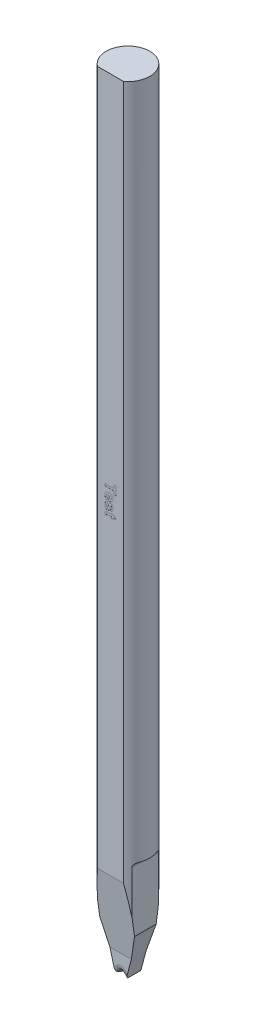
from build123d import *

# Parameters (mm, degrees)
SKETCH_TL_CUTTING_R       = 1.99771
TL_CUTTING_DEPTH          = 72.009
SKETCH_TDF_GRINDING_W     = 4.01542
SKETCH_TDF_GRINDING_H     = 4.01542
TDF_GRINDING_DEPTH        = 73.064400167
ENGRAVING_DEPTH           = 0.005
VW_VR_GRINDING_DEPTH      = 2.00771
VW_VR_GRINDING_DEPTH_BACK = 2.00771
ISA_GRINDING_DEPTH        = 2.00771
ISA_GRINDING_DEPTH_BACK   = 2.00771
PRE_FRX_BRX_DEPTH         = 2.00771
PRE_FRX_BRX_DEPTH_BACK    = 2.00771
SKETCH_PRE_FRX_BRX_W      = 1.33334
SKETCH_PRE_FRX_BRX_H      = 1.80086
FR_EDM_R                  = 0.50038
BR_EDM_R                  = 0.24892
FA_BA_GRINDING_DEPTH      = 2.00771
FA_BA_GRINDING_DEPTH_BACK = 2.00771


with BuildPart() as part:
    # sketch_TL_cutting → TL_cutting (new body)
    with BuildSketch(Plane(origin=(0, 0, 0), x_dir=(1, 0, 0), z_dir=(0, 1, 0))):
        Circle(SKETCH_TL_CUTTING_R)
    extrude(amount=TL_CUTTING_DEPTH)

    # sketch_TDF_grinding → TDF_grinding (cut, through all)
    with BuildSketch(Plane(origin=(0, 0, 0), x_dir=(1, 0, 0), z_dir=(0, 1, 0))):
        with Locations((0, -3.60918)):
            Rectangle(SKETCH_TDF_GRINDING_W, SKETCH_TDF_GRINDING_H)
    extrude(amount=TDF_GRINDING_DEPTH, mode=Mode.SUBTRACT)

    # sketch_engraving → engraving (cut)
    # profile 1 of 4: a face of its own
    with BuildSketch(Plane.XY.offset(1.60147)):
        Polygon((-0.5, 39.271616667), (0.333333333, 39.271616667), (0.333333333, 39.566488462), (0.5, 39.566488462), (0.5, 38.784437179), (0.333333333, 38.784437179), (0.333333333, 39.079308974), (-0.5, 39.079308974), align=None)
    # profile 2 of 4: a face of its own
    with BuildSketch(Plane.XY.offset(1.60147)):
        with BuildLine():
            Line((-0.269230769, 38.245975641), (-0.294871795, 38.053667949))
            add(Edge.make_bspline(
                [(-0.294871795, 38.053667949), (-0.303536255, 38.05681341), (-0.32057243, 38.062998057), (-0.344863965, 38.074297447), (-0.36753558, 38.086927941), (-0.38870841, 38.100828818), (-0.40841008, 38.115948344), (-0.426226149, 38.132786464), (-0.442819851, 38.150522903), (-0.457401048, 38.169899569), (-0.470514378, 38.190430953), (-0.481988402, 38.212220233), (-0.491332973, 38.235441665), (-0.499158418, 38.2597436), (-0.505404699, 38.285236347), (-0.509771463, 38.312023912), (-0.51242458, 38.340071927), (-0.512686872, 38.359217543), (-0.512820513, 38.368972436)],
                knots=[0, 0, 0, 0, 1.071172907, 2.106154283, 3.1104349, 4.085737425, 5.048416355, 5.993087888, 6.932482331, 7.868664062, 8.80754521, 9.762367971, 10.726735429, 11.713584758, 12.728370439, 13.774815933, 14.866245336, 16, 16, 16, 16], degree=3))
            add(Edge.make_bspline(
                [(-0.512820513, 38.368972436), (-0.512443282, 38.384215689), (-0.51171073, 38.413816927), (-0.505852845, 38.456649619), (-0.496231539, 38.496468957), (-0.482996444, 38.533340518), (-0.465262586, 38.566968048), (-0.443980436, 38.597603584), (-0.418772334, 38.625277377), (-0.399264925, 38.640792304), (-0.389423077, 38.648619872)],
                knots=[0, 0, 0, 0, 1.15090686, 2.234973544, 3.257507168, 4.240282073, 5.185422152, 6.119941203, 7.051475585, 8, 8, 8, 8], degree=3))
            add(Edge.make_bspline(
                [(-0.389423077, 38.648619872), (-0.381046549, 38.654394615), (-0.364178666, 38.666023262), (-0.336856894, 38.680508975), (-0.307933811, 38.692778192), (-0.277558503, 38.703026223), (-0.245440266, 38.710801085), (-0.211772448, 38.716423673), (-0.176408554, 38.719566462), (-0.152316287, 38.7200751), (-0.140024038, 38.720334615)],
                knots=[0, 0, 0, 0, 0.924739034, 1.862154457, 2.806332648, 3.78003102, 4.774289357, 5.808656063, 6.881942244, 8, 8, 8, 8], degree=3))
            add(Edge.make_bspline(
                [(-0.140024038, 38.720334615), (-0.125455951, 38.720092004), (-0.096984123, 38.719617846), (-0.055513373, 38.715154498), (-0.016425807, 38.707818358), (0.020119322, 38.697410859), (0.054294407, 38.68413375), (0.086062076, 38.66795031), (0.115338437, 38.648566538), (0.141890673, 38.626338649), (0.165678093, 38.601889773), (0.186654734, 38.575901172), (0.204171816, 38.548142799), (0.218793413, 38.519037282), (0.22973775, 38.488097916), (0.237794287, 38.455712574), (0.242700593, 38.421739484), (0.243290251, 38.398569286), (0.243589744, 38.386800962)],
                knots=[0, 0, 0, 0, 1.22208028, 2.38843015, 3.495001974, 4.555551, 5.572102979, 6.566928721, 7.541284444, 8.51191166, 9.466805643, 10.399597494, 11.308905182, 12.215983304, 13.126946664, 14.056451325, 15.012856426, 16, 16, 16, 16], degree=3))
            add(Edge.make_bspline(
                [(0.243589744, 38.386800962), (0.243311261, 38.373629824), (0.242766301, 38.347855288), (0.237650471, 38.310275991), (0.229328986, 38.274795107), (0.217373094, 38.241526508), (0.202375393, 38.21026058), (0.183809309, 38.18120302), (0.161721866, 38.15441694), (0.136526927, 38.129657507), (0.107657568, 38.107731168), (0.075306929, 38.088791461), (0.039386169, 38.073001438), (-6.4395e-05, 38.06017711), (-0.043155579, 38.050702551), (-0.089766999, 38.044217904), (-0.139896801, 38.040520273), (-0.174473137, 38.040736108), (-0.192307692, 38.040847436)],
                knots=[0, 0, 0, 0, 0.994914541, 1.946943474, 2.860007193, 3.744253739, 4.613162343, 5.475451996, 6.343187588, 7.231728884, 8.139057486, 9.075471918, 10.058180036, 11.098621179, 12.205332334, 13.387827392, 14.65263521, 16, 16, 16, 16], degree=3))
            Line((-0.192307692, 38.040847436), (-0.192307692, 38.528026923))
            add(Edge.make_bspline(
                [(-0.192307692, 38.528026923), (-0.199190121, 38.527709192), (-0.212592416, 38.527090467), (-0.232195578, 38.524796627), (-0.250479259, 38.520657909), (-0.267812634, 38.515788971), (-0.283741268, 38.50914089), (-0.298585088, 38.501254096), (-0.312263908, 38.492043492), (-0.324637591, 38.481432151), (-0.335614883, 38.46980259), (-0.345276708, 38.457539783), (-0.353640982, 38.4446797), (-0.360224098, 38.430905392), (-0.365494916, 38.416500027), (-0.36902659, 38.40135782), (-0.371322908, 38.385602139), (-0.371635397, 38.374856811), (-0.371794872, 38.369373077)],
                knots=[0, 0, 0, 0, 1.231638706, 2.398395625, 3.522289669, 4.579947828, 5.613000372, 6.600997726, 7.58103015, 8.554716894, 9.508889492, 10.435482506, 11.342805004, 12.245087657, 13.158904806, 14.079635201, 15.019967576, 16, 16, 16, 16], degree=3))
            add(Edge.make_bspline(
                [(-0.371794872, 38.369373077), (-0.37147122, 38.362073831), (-0.370844355, 38.347936282), (-0.366452232, 38.327557955), (-0.358712143, 38.309068041), (-0.34792154, 38.292272797), (-0.333591606, 38.277328375), (-0.315339539, 38.264799025), (-0.293735149, 38.253844255), (-0.277667648, 38.248684811), (-0.269230769, 38.245975641)],
                knots=[0, 0, 0, 0, 1.004430367, 1.945431754, 2.851730883, 3.749038912, 4.678525969, 5.68064125, 6.782128749, 8, 8, 8, 8], degree=3))
        make_face()
        with BuildLine():
            add(Edge.make_bspline(
                [(-0.076923077, 38.233155128), (-0.0698403, 38.233483639), (-0.056046098, 38.234123437), (-0.035946701, 38.236260056), (-0.017148581, 38.239753965), (0.000200148, 38.244909045), (0.016332408, 38.250857578), (0.031252693, 38.258017474), (0.044751188, 38.266665927), (0.056718236, 38.276608372), (0.067663617, 38.28708548), (0.076749299, 38.298677324), (0.084970517, 38.310417813), (0.091312261, 38.322949906), (0.09644632, 38.335935061), (0.100044461, 38.349509996), (0.102017666, 38.363706733), (0.102379943, 38.373306988), (0.102564103, 38.378187179)],
                knots=[0, 0, 0, 0, 1.317155349, 2.565252013, 3.752617023, 4.863710936, 5.923691592, 6.944619286, 7.932291025, 8.893346204, 9.832040666, 10.740742434, 11.625065814, 12.490654946, 13.343074709, 14.215747339, 15.092993572, 16, 16, 16, 16], degree=3))
            add(Edge.make_bspline(
                [(0.102564103, 38.378187179), (0.102394824, 38.383402132), (0.102061251, 38.393678456), (0.099884751, 38.408748379), (0.096024349, 38.423032459), (0.09079949, 38.436639555), (0.083918898, 38.449540507), (0.0754807, 38.461735603), (0.065590542, 38.473270723), (0.058097667, 38.480221161), (0.054286859, 38.48375609)],
                knots=[0, 0, 0, 0, 1.043516863, 2.056302107, 3.038302912, 3.998520634, 4.966791607, 5.956307719, 6.960596886, 8, 8, 8, 8], degree=3))
            add(Edge.make_bspline(
                [(0.054286859, 38.48375609), (0.050143389, 38.487049206), (0.04181864, 38.493665486), (0.028026538, 38.502086823), (0.013220128, 38.509308805), (-0.002752654, 38.515151047), (-0.019802657, 38.519527844), (-0.037911914, 38.522448646), (-0.057052364, 38.524307277), (-0.070174406, 38.524514764), (-0.076923077, 38.524621474)],
                knots=[0, 0, 0, 0, 0.903766344, 1.81577923, 2.754803886, 3.715080786, 4.716965023, 5.758108642, 6.846994466, 8, 8, 8, 8], degree=3))
            Line((-0.076923077, 38.524621474), (-0.076923077, 38.233155128))
        make_face(mode=Mode.SUBTRACT)
    # profile 3 of 4: a face of its own
    with BuildSketch(Plane.XY.offset(1.60147)):
        with BuildLine():
            Line((-0.282051282, 37.963924359), (-0.256410256, 37.771616667))
            add(Edge.make_bspline(
                [(-0.256410256, 37.771616667), (-0.265392316, 37.769308786), (-0.282694005, 37.764863233), (-0.306215409, 37.753602879), (-0.326584524, 37.739486729), (-0.343301626, 37.721699528), (-0.356462242, 37.70035559), (-0.365240358, 37.675137989), (-0.37099337, 37.646408413), (-0.37151826, 37.62594851), (-0.371794872, 37.615166346)],
                knots=[0, 0, 0, 0, 1.039319445, 2.001988807, 2.911187514, 3.807680854, 4.723381073, 5.705509029, 6.790826147, 8, 8, 8, 8], degree=3))
            add(Edge.make_bspline(
                [(-0.371794872, 37.615166346), (-0.371595476, 37.6033799), (-0.371221553, 37.581277061), (-0.365704055, 37.55056632), (-0.358276706, 37.523830835), (-0.349217718, 37.509115088), (-0.344951923, 37.502185577)],
                knots=[0, 0, 0, 0, 1.198484229, 2.247488828, 3.174758401, 4, 4, 4, 4], degree=3))
            add(Edge.make_bspline(
                [(-0.344951923, 37.502185577), (-0.341742613, 37.498232291), (-0.33550118, 37.490543982), (-0.322943507, 37.482741952), (-0.309159996, 37.477548698), (-0.299329041, 37.477017951), (-0.294270833, 37.476744872)],
                knots=[0, 0, 0, 0, 1.030872991, 2.004830756, 2.973448591, 4, 4, 4, 4], degree=3))
            add(Edge.make_bspline(
                [(-0.294270833, 37.476744872), (-0.29084777, 37.476875774), (-0.284161693, 37.477131458), (-0.274600311, 37.479806895), (-0.265958556, 37.484297368), (-0.261079044, 37.488462599), (-0.258613782, 37.490566987)],
                knots=[0, 0, 0, 0, 1.045349703, 2.041822997, 3.010676005, 4, 4, 4, 4], degree=3))
            add(Edge.make_bspline(
                [(-0.258613782, 37.490566987), (-0.256288912, 37.493632785), (-0.250848162, 37.500807485), (-0.244943535, 37.515139431), (-0.238900398, 37.533545958), (-0.235595409, 37.547422737), (-0.233774038, 37.555070192)],
                knots=[0, 0, 0, 0, 0.66039037, 1.545471194, 2.647315926, 4, 4, 4, 4], degree=3))
            add(Edge.make_bspline(
                [(-0.233774038, 37.555070192), (-0.229705714, 37.573716174), (-0.22194668, 37.609277449), (-0.209757361, 37.659778792), (-0.19774553, 37.704848274), (-0.186203797, 37.744635975), (-0.174918001, 37.779106417), (-0.163759522, 37.808213265), (-0.153049809, 37.832079784), (-0.144879526, 37.845529946), (-0.141225962, 37.851544551)],
                knots=[0, 0, 0, 0, 1.469060602, 2.801765397, 3.998694248, 5.05919304, 5.990566457, 6.789528243, 7.45870461, 8, 8, 8, 8], degree=3))
            add(Edge.make_bspline(
                [(-0.141225962, 37.851544551), (-0.136226873, 37.858402589), (-0.126466322, 37.871792676), (-0.109659896, 37.889628181), (-0.091386741, 37.904751367), (-0.071590355, 37.917116522), (-0.050318141, 37.926554447), (-0.027668833, 37.93345572), (-0.003546555, 37.937452085), (0.013006297, 37.938002888), (0.021434295, 37.938283333)],
                knots=[0, 0, 0, 0, 1.056974227, 2.063706289, 3.045111424, 4.005796011, 4.963194591, 5.937303459, 6.949763919, 8, 8, 8, 8], degree=3))
            add(Edge.make_bspline(
                [(0.021434295, 37.938283333), (0.029124721, 37.938038093), (0.04431443, 37.937553707), (0.06658025, 37.934147557), (0.08788195, 37.928268829), (0.108244702, 37.919987356), (0.127669101, 37.909371186), (0.146109736, 37.896355985), (0.163499189, 37.88105958), (0.18008332, 37.863595441), (0.195101302, 37.843560205), (0.208193344, 37.820898789), (0.219189739, 37.795682252), (0.228160641, 37.767891932), (0.235116926, 37.737522892), (0.240034197, 37.704574691), (0.243059894, 37.669109271), (0.243409494, 37.644619752), (0.243589744, 37.631993269)],
                knots=[0, 0, 0, 0, 0.866628782, 1.711717909, 2.531497577, 3.35182975, 4.18367977, 5.02092497, 5.890294189, 6.790012725, 7.730721042, 8.705258537, 9.733001209, 10.825364086, 11.991866675, 13.2403337, 14.577151382, 16, 16, 16, 16], degree=3))
            add(Edge.make_bspline(
                [(0.243589744, 37.631993269), (0.243446899, 37.619969386), (0.243169634, 37.596630784), (0.240731219, 37.562865029), (0.236899188, 37.531447838), (0.230948561, 37.502523753), (0.223974046, 37.475757243), (0.214898634, 37.451540721), (0.204526083, 37.429543073), (0.19215876, 37.410057891), (0.178364946, 37.392312816), (0.162861914, 37.376343528), (0.145977964, 37.361660901), (0.127601745, 37.348295817), (0.107595464, 37.336522221), (0.085933763, 37.326346763), (0.062896123, 37.317199482), (0.046718542, 37.312484647), (0.038461538, 37.310078205)],
                knots=[0, 0, 0, 0, 1.38031105, 2.679211982, 3.884975083, 5.011116117, 6.067453267, 7.057174624, 7.976132094, 8.854607518, 9.701157373, 10.55241532, 11.405604341, 12.267429654, 13.157569633, 14.066300783, 15.01304394, 16, 16, 16, 16], degree=3))
            Line((0.038461538, 37.310078205), (0.012820513, 37.502385897))
            add(Edge.make_bspline(
                [(0.012820513, 37.502385897), (0.019716836, 37.504290158), (0.033104434, 37.507986834), (0.051141649, 37.517171289), (0.066892754, 37.528329959), (0.079947134, 37.542237254), (0.090451531, 37.559028536), (0.097449696, 37.579068362), (0.101956518, 37.602011397), (0.102353946, 37.618347086), (0.102564103, 37.626985256)],
                knots=[0, 0, 0, 0, 1.018112573, 1.976427386, 2.86989064, 3.759232895, 4.678909429, 5.673224298, 6.76962116, 8, 8, 8, 8], degree=3))
            add(Edge.make_bspline(
                [(0.102564103, 37.626985256), (0.102424935, 37.637692738), (0.102166286, 37.657593004), (0.098045863, 37.684877454), (0.092323932, 37.707867567), (0.085068416, 37.720248276), (0.081730769, 37.72594359)],
                knots=[0, 0, 0, 0, 1.252081424, 2.327041614, 3.230413832, 4, 4, 4, 4], degree=3))
            add(Edge.make_bspline(
                [(0.081730769, 37.72594359), (0.079197183, 37.729025647), (0.074335374, 37.73493994), (0.064913663, 37.741325197), (0.054472552, 37.745380868), (0.047046059, 37.745775133), (0.043269231, 37.745975641)],
                knots=[0, 0, 0, 0, 1.057832138, 2.029920023, 2.998093444, 4, 4, 4, 4], degree=3))
            add(Edge.make_bspline(
                [(0.043269231, 37.745975641), (0.040033897, 37.745731951), (0.033581253, 37.745245928), (0.024317894, 37.741659065), (0.015848023, 37.735669869), (0.011363278, 37.730206983), (0.009014423, 37.727345833)],
                knots=[0, 0, 0, 0, 0.958252903, 1.911167308, 2.905987877, 4, 4, 4, 4], degree=3))
            add(Edge.make_bspline(
                [(0.009014423, 37.727345833), (0.007272068, 37.724647565), (0.003109312, 37.718200986), (-0.001987057, 37.705738151), (-0.007675168, 37.689579504), (-0.014111167, 37.66960725), (-0.021107365, 37.645777407), (-0.028443749, 37.617971341), (-0.036209836, 37.586289843), (-0.044306367, 37.551842427), (-0.052630208, 37.516856792), (-0.061887965, 37.483641001), (-0.071549097, 37.453239038), (-0.082070854, 37.425689873), (-0.092726589, 37.400866602), (-0.103967718, 37.378881411), (-0.115635077, 37.359626043), (-0.124552329, 37.348458363), (-0.12880609, 37.34313109)],
                knots=[0, 0, 0, 0, 0.374467347, 0.894660112, 1.565561736, 2.376893081, 3.344161852, 4.465830414, 5.734896654, 7.153471884, 8.598442955, 9.934182422, 11.179548312, 12.322244199, 13.376910086, 14.332509539, 15.204563813, 16, 16, 16, 16], degree=3))
            add(Edge.make_bspline(
                [(-0.12880609, 37.34313109), (-0.133161207, 37.338397939), (-0.141766598, 37.329045582), (-0.156708359, 37.317267826), (-0.172517892, 37.306827029), (-0.189865737, 37.298743237), (-0.208297358, 37.292224129), (-0.22803715, 37.287604372), (-0.249067342, 37.285099915), (-0.263482048, 37.284661013), (-0.270833333, 37.284437179)],
                knots=[0, 0, 0, 0, 0.971012965, 1.9186502, 2.868006896, 3.82989672, 4.803792202, 5.820095146, 6.888280979, 8, 8, 8, 8], degree=3))
            add(Edge.make_bspline(
                [(-0.270833333, 37.284437179), (-0.278992426, 37.284735435), (-0.295065709, 37.285322994), (-0.31877832, 37.289130371), (-0.34148056, 37.29590885), (-0.363516332, 37.304828098), (-0.384457432, 37.316865706), (-0.404505714, 37.331398777), (-0.423895683, 37.348291114), (-0.442088641, 37.367910642), (-0.458702848, 37.390179566), (-0.473419718, 37.414886937), (-0.485630501, 37.442216147), (-0.495629007, 37.472011312), (-0.503343888, 37.504335073), (-0.50897222, 37.5391443), (-0.51206406, 37.576448424), (-0.512563429, 37.602140104), (-0.512820513, 37.615366667)],
                knots=[0, 0, 0, 0, 0.853005228, 1.680406763, 2.502135431, 3.325285981, 4.159928718, 5.020072903, 5.910500533, 6.844018396, 7.811498054, 8.809909951, 9.84399402, 10.934451331, 12.090792638, 13.314110396, 14.617253208, 16, 16, 16, 16], degree=3))
            add(Edge.make_bspline(
                [(-0.512820513, 37.615366667), (-0.512612848, 37.62745682), (-0.51220841, 37.65100301), (-0.509517578, 37.685359126), (-0.504407099, 37.717718929), (-0.497724819, 37.748140888), (-0.489040825, 37.776683279), (-0.478560901, 37.803305401), (-0.465826863, 37.827975098), (-0.451129931, 37.85061131), (-0.434940139, 37.871488229), (-0.417179349, 37.890400578), (-0.398157879, 37.907538513), (-0.377590042, 37.922532075), (-0.355813358, 37.935929627), (-0.332587631, 37.947268496), (-0.307935086, 37.956851386), (-0.290780182, 37.961539112), (-0.282051282, 37.963924359)],
                knots=[0, 0, 0, 0, 1.27602789, 2.485129288, 3.633323873, 4.730967468, 5.769800648, 6.778755409, 7.74637841, 8.694428407, 9.62340196, 10.530821678, 11.429165597, 12.321379864, 13.213343615, 14.124177522, 15.045528489, 16, 16, 16, 16], degree=3))
        make_face()
    # profile 4 of 4: a face of its own
    with BuildSketch(Plane.XY.offset(1.60147)):
        with BuildLine():
            Line((0.230769231, 36.771616667), (0.08974359, 36.771616667))
            Line((0.08974359, 36.771616667), (0.08974359, 36.912642308))
            Line((0.08974359, 36.912642308), (-0.224358974, 36.912642308))
            add(Edge.make_bspline(
                [(-0.224358974, 36.912642308), (-0.231904339, 36.912655556), (-0.246127351, 36.91268053), (-0.266228543, 36.912516237), (-0.283853768, 36.912035979), (-0.299018236, 36.911753629), (-0.311701045, 36.911074066), (-0.321861303, 36.910566773), (-0.329566697, 36.909844169), (-0.338907815, 36.908116455), (-0.35057578, 36.903088956), (-0.360389431, 36.893421483), (-0.366182432, 36.883899126), (-0.369474906, 36.875870251), (-0.371514578, 36.867071013), (-0.371700117, 36.86090399), (-0.371794872, 36.857754487)],
                knots=[0, 0, 0, 0, 1.773599637, 3.343235314, 4.724802322, 5.918078765, 6.908020279, 7.709878159, 8.309605123, 8.725167438, 9.94114383, 11.228754835, 11.890951744, 12.552590386, 13.260806876, 14, 14, 14, 14], degree=3))
            add(Edge.make_bspline(
                [(-0.371794872, 36.857754487), (-0.371507964, 36.852599495), (-0.37087716, 36.841265574), (-0.367095421, 36.822790849), (-0.361305779, 36.801332787), (-0.356131124, 36.786144648), (-0.353365385, 36.778026923)],
                knots=[0, 0, 0, 0, 0.75345353, 1.656565626, 2.747486109, 4, 4, 4, 4], degree=3))
            Line((-0.353365385, 36.778026923), (-0.487379808, 36.758796154))
            add(Edge.make_bspline(
                [(-0.487379808, 36.758796154), (-0.491390152, 36.770473487), (-0.499569528, 36.79429022), (-0.506906498, 36.832144946), (-0.512003384, 36.872037386), (-0.512543433, 36.899403162), (-0.512820513, 36.91344359)],
                knots=[0, 0, 0, 0, 0.939563481, 1.916305015, 2.930928536, 4, 4, 4, 4], degree=3))
            add(Edge.make_bspline(
                [(-0.512820513, 36.91344359), (-0.512564303, 36.922066227), (-0.512063975, 36.938904556), (-0.50889268, 36.963561395), (-0.50326966, 36.986850275), (-0.495519476, 37.008603835), (-0.485995694, 37.028249445), (-0.475305475, 37.045552282), (-0.462868601, 37.059745517), (-0.449141562, 37.071601308), (-0.433202705, 37.080952612), (-0.415065056, 37.088376561), (-0.394648734, 37.094756812), (-0.380046946, 37.097370521), (-0.372395833, 37.098740064)],
                knots=[0, 0, 0, 0, 1.203015215, 2.349253984, 3.460901624, 4.539344044, 5.564274864, 6.502382232, 7.367332183, 8.186789841, 9.022345106, 9.932420497, 10.916620053, 12, 12, 12, 12], degree=3))
            add(Edge.make_bspline(
                [(-0.372395833, 37.098740064), (-0.369192653, 37.099220274), (-0.362066116, 37.100288659), (-0.35025766, 37.101738229), (-0.336212257, 37.102632671), (-0.319980191, 37.103365635), (-0.301558032, 37.104305843), (-0.280981809, 37.104504627), (-0.258215711, 37.105079957), (-0.242321525, 37.104994749), (-0.233974359, 37.10495)],
                knots=[0, 0, 0, 0, 0.560521704, 1.24706641, 2.057998689, 2.995119087, 4.059211621, 5.249632546, 6.555586685, 8, 8, 8, 8], degree=3))
            Line((-0.233974359, 37.10495), (0.08974359, 37.10495))
            Line((0.08974359, 37.10495), (0.08974359, 37.19469359))
            Line((0.08974359, 37.19469359), (0.230769231, 37.19469359))
            Line((0.230769231, 37.19469359), (0.230769231, 37.10495))
            Line((0.230769231, 37.10495), (0.371794872, 37.10495))
            Line((0.371794872, 37.10495), (0.487179487, 36.912642308))
            Line((0.487179487, 36.912642308), (0.230769231, 36.912642308))
            Line((0.230769231, 36.912642308), (0.230769231, 36.771616667))
        make_face()
    extrude(amount=-ENGRAVING_DEPTH, mode=Mode.SUBTRACT)

    # sketch_VW_VR_grinding → VW_VR_grinding (cut, two sides: drawn at the far end of the back side and taken through both)
    with BuildSketch(Plane.XY.offset(-VW_VR_GRINDING_DEPTH_BACK)):
        with BuildLine():
            Line((-1.59004, -0.01), (-1.59004, 9.681972))
            ThreePointArc((-1.59004, 9.681972), (-1.683182387, 9.906837613), (-1.908048, 9.99998))
            Line((-1.908048, 9.99998), (-2.00771, 9.99998))
            Line((-2.00771, 9.99998), (-2.00771, -0.01))
            Line((-2.00771, -0.01), (-1.59004, -0.01))
        make_face()
        with BuildLine():
            Line((1.59004, -0.01), (1.59004, 9.681972))
            ThreePointArc((1.59004, 9.681972), (1.683182387, 9.906837613), (1.908048, 9.99998))
            Line((1.908048, 9.99998), (2.00771, 9.99998))
            Line((2.00771, 9.99998), (2.00771, -0.01))
            Line((2.00771, -0.01), (1.59004, -0.01))
        make_face()
    extrude(amount=VW_VR_GRINDING_DEPTH + VW_VR_GRINDING_DEPTH_BACK, mode=Mode.SUBTRACT)

    # sketch_ISA_grinding → ISA_grinding (cut, two sides: drawn at the far end of the back side and taken through both)
    with BuildSketch(Plane.XY.offset(-ISA_GRINDING_DEPTH_BACK)):
        Polygon((-0.50038, 0), (-2.00771, 5.625432144), (-2.00771, -0.01), (2.00771, -0.01), (2.00771, 5.625432144), (0.50038, 0), align=None)
    extrude(amount=ISA_GRINDING_DEPTH + ISA_GRINDING_DEPTH_BACK, mode=Mode.SUBTRACT)

    # sketch_pre_FRX_BRX → pre_FRX_BRX (cut, two sides: drawn at the far end of the back side and taken through both)
    with BuildSketch(Plane(origin=(0, 0, 0), x_dir=(0, 0, -1), z_dir=(1, 0, 0)).offset(-PRE_FRX_BRX_DEPTH_BACK)):
        with Locations((-1.34104, 0.89043)):
            Rectangle(SKETCH_PRE_FRX_BRX_W, SKETCH_PRE_FRX_BRX_H)
        with Locations((1.34104, 0.89043)):
            Rectangle(SKETCH_PRE_FRX_BRX_W, SKETCH_PRE_FRX_BRX_H)
    extrude(amount=PRE_FRX_BRX_DEPTH + PRE_FRX_BRX_DEPTH_BACK, mode=Mode.SUBTRACT)

    # V-Groove_EDM: sweep along a path in sketch_contour_V-Groove
    with BuildLine(Plane(origin=(0, 0, 0), x_dir=(0, 0, -1), z_dir=(1, 0, 0))) as v_groove_edm_path:
        Line((-1.60147, 0.28448), (0, 0.28448))
        Line((0, 0.28448), (1.99771, 0.28448))
    # sketch_section_V-Groove → V-Groove_EDM (sweep, cut)
    with BuildSketch(Plane.XY.offset(1.60147)):
        with BuildLine():
            Line((-3.1496, -2.8448), (-0.03468841, 0.27011159))
            ThreePointArc((-0.03468841, 0.27011159), (0, 0.28448), (0.03468841, 0.27011159))
            Line((0.03468841, 0.27011159), (3.1496, -2.8448))
            Line((3.1496, -2.8448), (-3.1496, -2.8448))
        make_face()
    sweep(path=v_groove_edm_path.line, mode=Mode.SUBTRACT)

    # FR_EDM
    fr_edm_edges = [part.edges().sort_by_distance(p)[0] for p in [
        (0.169744205, 0.135055795, 0.67437),
        (0, 0.28448, 0.67437),
        (-0.169744205, 0.135055795, 0.67437),
    ]]
    fillet(fr_edm_edges, radius=FR_EDM_R)

    # BR_EDM
    br_edm_edges = [part.edges().sort_by_distance(p)[0] for p in [
        (0.169744205, 0.135055795, -0.67437),
        (0, 0.28448, -0.67437),
        (-0.169744205, 0.135055795, -0.67437),
    ]]
    fillet(br_edm_edges, radius=BR_EDM_R)

    # sketch_FA_BA_grinding → FA_BA_grinding (cut, two sides: drawn at the far end of the back side and taken through both)
    with BuildSketch(Plane(origin=(0, 0, 0), x_dir=(0, 0, -1), z_dir=(1, 0, 0)).offset(-FA_BA_GRINDING_DEPTH_BACK)):
        Polygon((2.99771, 18.332283091), (2.99771, -0.1), (0.67437, -0.1), (0.67437, 1.80086), align=None)
        Polygon((-3.622078656, 22.774896919), (-0.67437, 1.80086), (-0.67437, -0.1), (-3.622078656, -0.1), align=None)
    extrude(amount=FA_BA_GRINDING_DEPTH + FA_BA_GRINDING_DEPTH_BACK, mode=Mode.SUBTRACT)


solid = part.part
